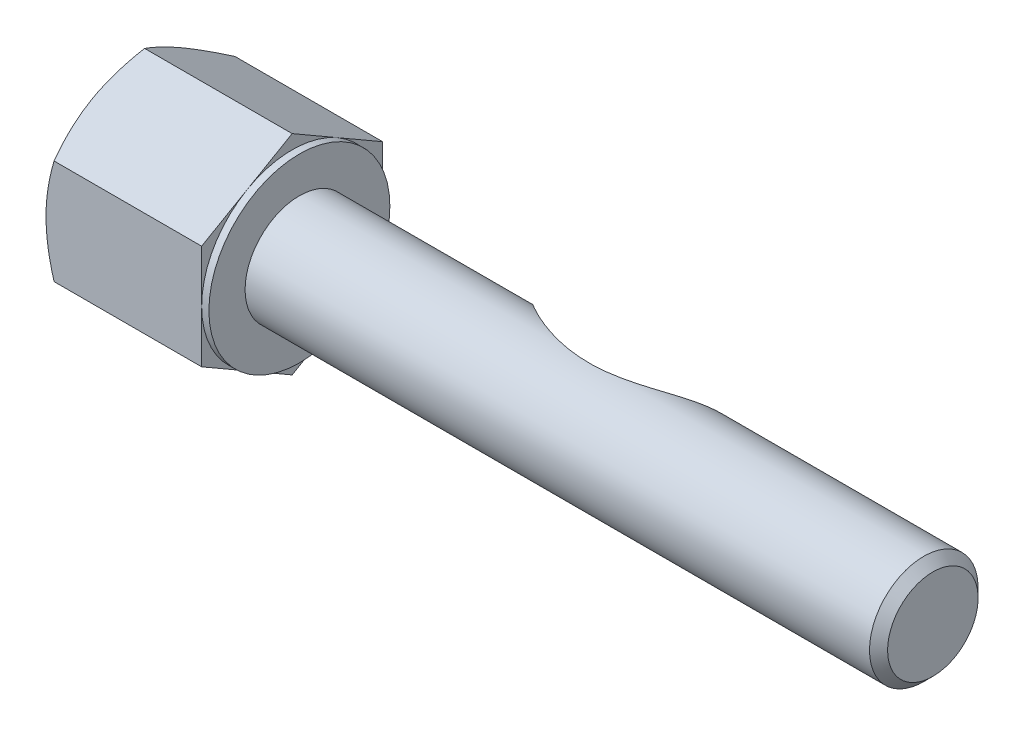
from build123d import *

# Parameters (mm, degrees)
BASEHEAD_DEPTH          = 18
SKETCH4_W               = 0.8
SKETCH4_H               = 11.547005384
CUT_EXTRUDE1_DEPTH      = 90.315918702
CUT_EXTRUDE1_DEPTH_BACK = 90.315918702
SKETCH6_R               = 15


# Read off the part's stored shape, not the designer's step: HeadChamfer
with BuildPart() as part:
    # Sketch1 → BaseHead (new body)
    with BuildSketch(Plane(origin=(0, 0, 0), x_dir=(0, 0, -1), z_dir=(1, 0, 0))):
        Polygon((10, 5.773502692), (10, -5.773502692), (0, -11.547005384), (-10, -5.773502692), (-10, 5.773502692), (0, 11.547005384), align=None)
    extrude(amount=BASEHEAD_DEPTH)

    # HeadChamfer outline → HeadChamfer (revolve, cut)
    with BuildSketch(Plane.YX):
        Polygon((11.547005388, 0.893163977), (10, 0), (11.547005388, 0), align=None)
    revolve(axis=Axis((0, 0, 0), (1, 0, 0)), mode=Mode.SUBTRACT)

    # HeadChamfer 2 outline → HeadChamfer 2 (revolve)
    with BuildSketch(Plane.YX):
        Polygon((6, 18), (6, 87), (5, 88), (0, 88), (0, 18), align=None)
    revolve(axis=Axis((0, 0, 0), (1, 0, 0)))

    # Sketch4 → BearingFace (revolve, cut)
    with BuildSketch(Plane.XY, mode=Mode.PRIVATE) as bearingface_sk:
        with Locations((17.6, 15.773502692)):
            Rectangle(SKETCH4_W, SKETCH4_H)
    revolve(bearingface_sk.sketch.rotate(Axis((0, 0, 0), (1, 0, 0)), 90), axis=Axis((0, 0, 0), (1, 0, 0)), mode=Mode.SUBTRACT)

    # Sketch6 → Cut-Extrude1 (cut, two sides: drawn at the far end of the back side and taken through both)
    with BuildSketch(Plane(origin=(0, 0, 0), x_dir=(1, 0, 0), z_dir=(0, 1, 0)).offset(-CUT_EXTRUDE1_DEPTH_BACK)):
        with Locations((50, 15)):
            Circle(SKETCH6_R)
    extrude(amount=CUT_EXTRUDE1_DEPTH + CUT_EXTRUDE1_DEPTH_BACK, mode=Mode.SUBTRACT)


solid = part.part
